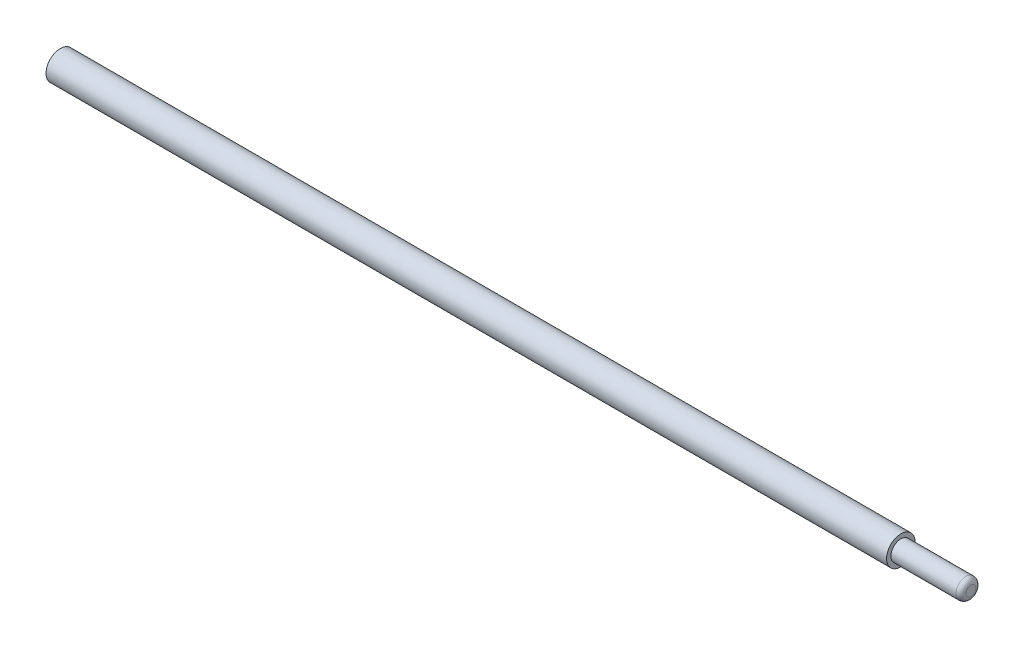
from build123d import *

# Parameters (mm, degrees)
SKETCH1_R           = 1.43
BOSS_EXTRUDE1_DEPTH = 84
SKETCH2_R           = 1
BOSS_EXTRUDE2_DEPTH = 7
FILLET1_R           = 0.5


with BuildPart() as part:
    # Sketch1 → Boss-Extrude1 (new body)
    with BuildSketch(Plane(origin=(0, 0, 0), x_dir=(0, 0, -1), z_dir=(1, 0, 0))):
        Circle(SKETCH1_R)
    extrude(amount=BOSS_EXTRUDE1_DEPTH)

    # Sketch2 → Boss-Extrude2 (add)
    with BuildSketch(Plane(origin=(84, 0, 0), x_dir=(0, 0, -1), z_dir=(1, 0, 0))):
        Circle(SKETCH2_R)
    extrude(amount=BOSS_EXTRUDE2_DEPTH)

    # Fillet1
    fillet1_edges = [part.edges().sort_by_distance(p)[0] for p in [
        (91, 0, 1),
    ]]
    fillet(fillet1_edges, radius=FILLET1_R)


solid = part.part
